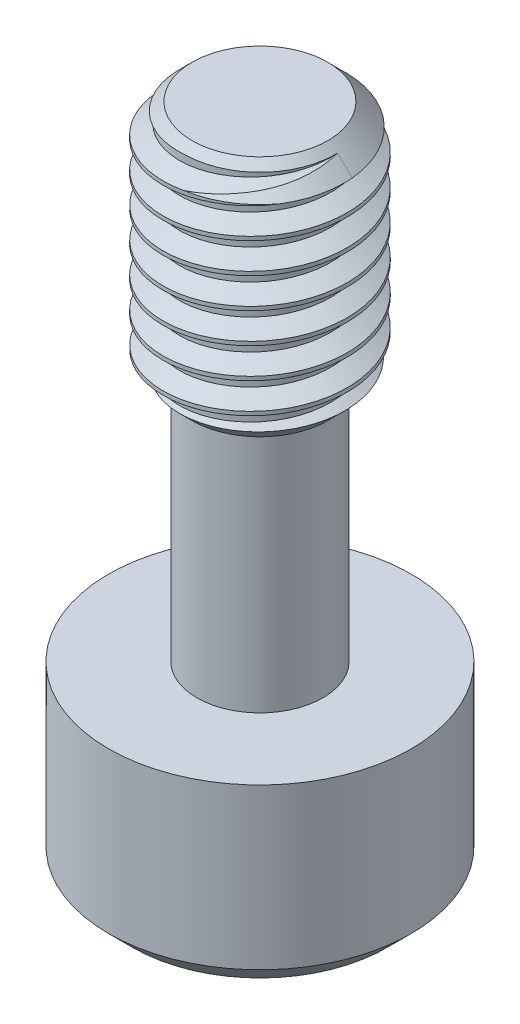
from build123d import *

# Parameters (mm, degrees)
SKETCH1_R           = 3.9624
BOSS_EXTRUDE1_DEPTH = 4.826
SKETCH2_R           = 1.651
BOSS_EXTRUDE2_DEPTH = 6.35
SKETCH3_R           = 2.413
BOSS_EXTRUDE3_DEPTH = 6.35
CHAMFER1_SIZE       = 0.635
CHAMFER3_SIZE       = 0.635
CUT_EXTRUDE2_DEPTH  = 2.54
THREAD1_PITCH       = 0.79375


with BuildPart() as part:
    # Sketch1 → Boss-Extrude1 (new body)
    with BuildSketch(Plane(origin=(0, 0, 0), x_dir=(1, 0, 0), z_dir=(0, 1, 0))):
        with Locations(Location((0, 0, 0), (0, 0, 270))):
            Circle(SKETCH1_R)
    extrude(amount=BOSS_EXTRUDE1_DEPTH)

    # Sketch2 → Boss-Extrude2 (add)
    with BuildSketch(Plane(origin=(0, 4.826, 0), x_dir=(1, 0, 0), z_dir=(0, 1, 0))):
        with Locations(Location((0, 0, 0), (0, 0, 270))):
            Circle(SKETCH2_R)
    extrude(amount=BOSS_EXTRUDE2_DEPTH)

    # Sketch3 → Boss-Extrude3 (add)
    with BuildSketch(Plane(origin=(0, 11.176, 0), x_dir=(1, 0, 0), z_dir=(0, 1, 0))):
        with Locations(Location((0, 0, 0), (0, 0, 270))):
            Circle(SKETCH3_R)
    extrude(amount=BOSS_EXTRUDE3_DEPTH)

    # Chamfer1
    chamfer1_edges = [part.edges().sort_by_distance(p)[0] for p in [
        (0, 0, -3.9624),
    ]]
    chamfer(chamfer1_edges, length=CHAMFER1_SIZE)

    # Chamfer3
    chamfer3_edges = [part.edges().sort_by_distance(p)[0] for p in [
        (0, 11.176, -2.413),
        (0, 17.526, -2.413),
    ]]
    chamfer(chamfer3_edges, length=CHAMFER3_SIZE)

    # Sketch9 → Cut-Extrude2 (cut)
    with BuildSketch(Plane.XZ):
        Polygon((2.346351494, 0), (1.173175747, 2.032), (-1.173175747, 2.032), (-2.346351494, 0), (-1.173175747, -2.032), (1.173175747, -2.032), align=None)
    extrude(amount=-CUT_EXTRUDE2_DEPTH, mode=Mode.SUBTRACT)

    # Thread1: the profile of Thread Profile1 profile screwed along a right-hand helix of 9.259843 turns, 8 arcs to a turn; built about Z, then put on its axis
    thread1_z = Axis((0, 0, 0), (0, 0, 1))
    thread1_corners = [(2.4133, 0, -0.000173205), (2.4133, 0, 0.694704453), (1.983370212, 0, 0.446484374), (1.983370212, 0, 0.248046874)]
    with BuildLine(mode=Mode.PRIVATE) as thread1_profile:
        Line(thread1_corners[0], thread1_corners[1])
        Line(thread1_corners[1], thread1_corners[2])
        Line(thread1_corners[2], thread1_corners[3])
        Line(thread1_corners[3], thread1_corners[0])
    thread1_cap = Face(thread1_profile.wire())
    thread1_turn_angles = [0, 22.5, 45, 67.5, 90, 112.5, 135, 157.5, 180, 202.5, 225, 247.5, 270, 292.5, 315, 337.5, 360]
    thread1_turn_weights = [1, 0.9238795325112867, 1, 0.9238795325112867, 1, 0.9238795325112867, 1, 0.9238795325112867, 1, 0.9238795325112867, 1, 0.9238795325112867, 1, 0.9238795325112867, 1, 0.9238795325112867, 1]
    thread1_turn_rails = [Edge.make_bspline([Vector(p[0], p[1], 0).rotate(thread1_z, thread1_turn_angles[k]) / thread1_turn_weights[k] + Vector(0, 0, p[2] + THREAD1_PITCH * thread1_turn_angles[k] / 360) for k in range(17)], [0, 0, 0, 1, 1, 2, 2, 3, 3, 4, 4, 5, 5, 6, 6, 7, 7, 8, 8, 8], 2, thread1_turn_weights) for p in thread1_corners]
    thread1_turn_sides = [Face.make_surface_from_curves(thread1_turn_rails[p[0]], thread1_turn_rails[p[1]]) for p in [(0, 1), (1, 2), (2, 3), (3, 0)]]
    thread1_last_angles = [3240, 3262.5, 3285, 3307.5, 3330, 3331.771653543, 3333.543307087]
    thread1_last_weights = [1, 0.9238795325112867, 1, 0.9238795325112867, 1, 0.9995219781697033, 1]
    thread1_last_rails = [Edge.make_bspline([Vector(p[0], p[1], 0).rotate(thread1_z, thread1_last_angles[k]) / thread1_last_weights[k] + Vector(0, 0, p[2] + THREAD1_PITCH * thread1_last_angles[k] / 360) for k in range(7)], [0, 0, 0, 1, 1, 2, 2, 3, 3, 3], 2, thread1_last_weights) for p in thread1_corners]
    thread1_last_sides = [Face.make_surface_from_curves(thread1_last_rails[p[0]], thread1_last_rails[p[1]]) for p in [(0, 1), (1, 2), (2, 3), (3, 0)]]
    thread1 = Plane(origin=(0, 18.161, 0), x_dir=(-1, 0, 0), z_dir=(0, -1, 0)) * Solid(Shell([*[p.moved(Location((0, 0, THREAD1_PITCH * i))) for i in range(9) for p in thread1_turn_sides], *thread1_last_sides, thread1_cap, thread1_cap.rotate(thread1_z, 3333.543307087).moved(Location((0, 0, THREAD1_PITCH * 3333.543307087 / 360)))]))
    add(thread1, mode=Mode.SUBTRACT)


solid = part.part
